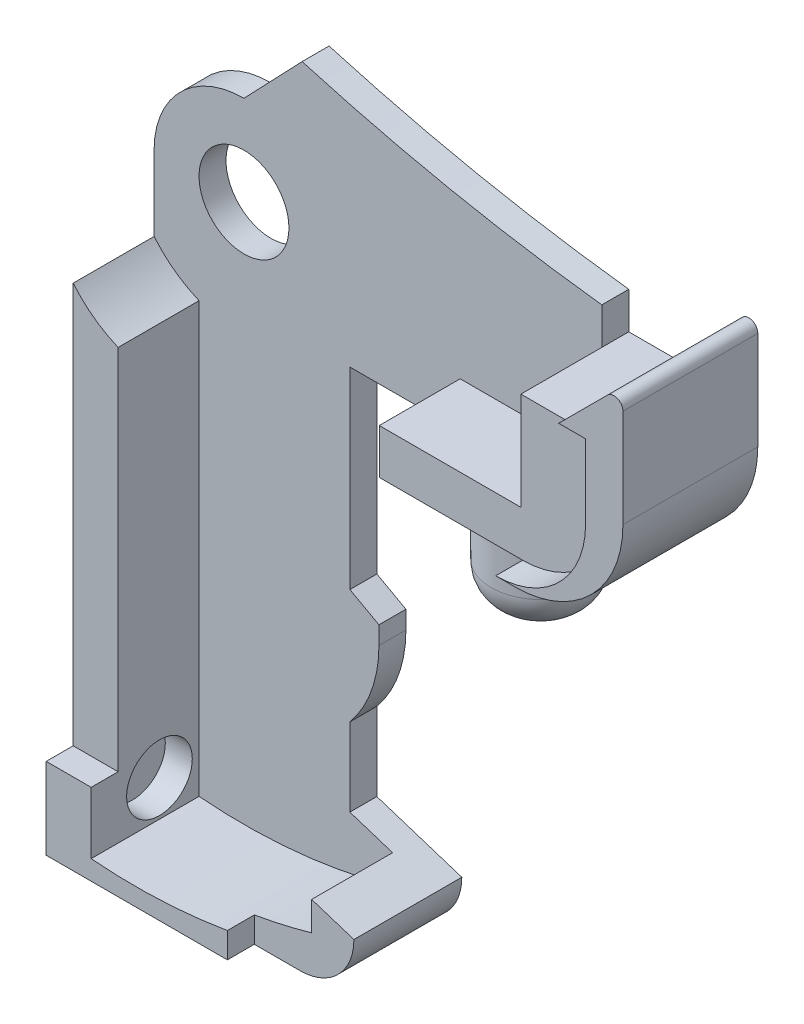
from build123d import *

# Parameters (mm, degrees)
EXTRUDE_3_DEPTH     = 7.5
EXTRUDE_3_2_DEPTH   = 7.5
EXTRUDE_4_DEPTH     = 6
SKETCH_1_8_R        = 2.5
EXTRUDE_5_DEPTH     = 1.5
SKETCH_2_R          = 2.75
EXTRUDE_6_DEPTH     = 2.45
SKETCH_4_R          = 2.75
EXTRUDE_7_DEPTH     = 2
SKETCH_5_R          = 1.825
CUT_EXTRUDE_1_DEPTH = 1.5


with BuildPart() as part:
    # 스케치1 → 보스-돌출3 (new body)
    with BuildSketch(Plane.XY):
        with BuildLine():
            Line((-2.5, -26.437677825), (-5, -26.437677825))
            Line((-5, -26.437677825), (-5, -30.96175738))
            Line((-5, -30.96175738), (5.076141326, -30.96175738))
            Line((5.076141326, -30.96175738), (5.076141326, -29.54601506))
            ThreePointArc((5.076141326, -29.54601506), (1.298498135, -29.950761581), (-2.5, -29.874474333))
            Line((-2.5, -29.874474333), (-2.5, -26.437677825))
        make_face()
    extrude(amount=EXTRUDE_3_DEPTH)

    # 스케치1<7> → 보스-돌출4 (add)
    with BuildSketch(Plane.XY):
        with BuildLine():
            Line((23.5, 2.950728465), (19.9, 2.950728465))
            Line((19.9, 2.950728465), (19.9, -2.5))
            Line((19.9, -2.5), (12.023157318, -2.5))
            Line((12.023157318, -2.5), (12.023157318, -5))
            Line((12.023157318, -5), (20, -5))
            ThreePointArc((20, -5), (23.535533906, -3.535533906), (25, 0))
            Line((25, 0), (25, 4.09591659))
            Line((25, 4.09591659), (23.5, 4.09591659))
            Line((23.5, 4.09591659), (23.5, 2.950728465))
        make_face()
        with BuildLine():
            ThreePointArc((-2.5, -6), (-3.862002616, -5.228282299), (-5, -4.153311931))
            Line((-5, -4.153311931), (-5, -26.437677825))
            Line((-5, -26.437677825), (-2.5, -26.437677825))
            Line((-2.5, -26.437677825), (-2.5, -6))
        make_face()
        with BuildLine():
            Line((5.076141326, -29.54601506), (5.076141326, -30.96175738))
            Line((5.076141326, -30.96175738), (7.613716386, -30.96175738))
            ThreePointArc((7.613716386, -30.96175738), (9.735036729, -30.083077723), (10.613716386, -27.96175738))
            Line((10.613716386, -27.96175738), (8.264928228, -27.20398111))
            Line((8.264928228, -27.20398111), (8.264928228, -28.81709871))
            ThreePointArc((8.264928228, -28.81709871), (6.680483813, -29.225080884), (5.076141326, -29.54601506))
        make_face()
    extrude(amount=EXTRUDE_4_DEPTH)


with BuildPart() as body_2:
    # 스케치1 → Extrude 3 2 (new body)
    with BuildSketch(Plane.XY):
        with BuildLine():
            ThreePointArc((26.22215467, 6.81807126), (26.767049777, 6.926457636), (27.075708061, 6.46451787))
            Line((27.075708061, 6.46451787), (27.075708061, 1))
            ThreePointArc((27.075708061, 1), (25.318348748, -3.242640687), (21.075708061, -5))
            Line((21.075708061, -5), (20, -5))
            ThreePointArc((20, -5), (23.535533906, -3.535533906), (25, 0))
            Line((25, 0), (25, 4.09591659))
            Line((25, 4.09591659), (23.5, 4.09591659))
            Line((23.5, 4.09591659), (26.22215467, 6.81807126))
        make_face()
    extrude(amount=EXTRUDE_3_2_DEPTH)


with BuildPart() as extrude_4_piece_1:
    # of the separate pieces the step leaves, piece 1, a body of its own (extrude_4_pieces)
    add(part.part.solids().sort_by_distance((-2.5, -29.874474333, 0))[0])



with BuildPart() as extrude_4_piece_2:
    # of the separate pieces the step leaves, piece 2, a body of its own (extrude_4_pieces)
    add(part.part.solids().sort_by_distance((23.5, 2.950728465, 0))[0])


with BuildPart() as extrude_4_piece_1_1:
    add(extrude_4_piece_1.part)

    add(extrude_4_piece_2.part)  # 보스-돌출5 merges 보스-돌출4 piece 2
    # 스케치1<8> → 보스-돌출5 (add)
    with BuildSketch(Plane.XY):
        with BuildLine():
            Line((3.231912185, 8.38327913), (0, 5))
            ThreePointArc((0, 5), (-3.535533906, 3.535533906), (-5, 0))
            Line((-5, 0), (-5, -4.153311931))
            ThreePointArc((-5, -4.153311931), (-3.862002616, -5.228282299), (-2.5, -6))
            Line((-2.5, -6), (-2.5, -29.874474333))
            ThreePointArc((-2.5, -29.874474333), (2.93054776, -29.83531643), (8.264928228, -28.81709871))
            Line((8.264928228, -28.81709871), (8.264928228, -27.20398111))
            Line((8.264928228, -27.20398111), (5.889404941, -26.437579436))
            Line((5.889404941, -26.437579436), (5.889404941, -22.090836604))
            ThreePointArc((5.889404941, -22.090836604), (7.089676261, -19.98856225), (7.506209453, -17.603880133))
            Line((7.506209453, -17.603880133), (7.506209453, -16.606122356))
            Line((7.506209453, -16.606122356), (5.889404941, -15.718789718))
            Line((5.889404941, -15.718789718), (5.889404941, -5))
            Line((5.889404941, -5), (12.023157318, -5))
            Line((12.023157318, -5), (12.023157318, -2.5))
            Line((12.023157318, -2.5), (19.9, -2.5))
            Line((19.9, -2.5), (19.9, 5))
            ThreePointArc((19.9, 5), (11.496170313, 6.34783243), (3.231912185, 8.38327913))
        make_face()
        Circle(SKETCH_1_8_R, mode=Mode.SUBTRACT)
    extrude(amount=EXTRUDE_5_DEPTH)

    # 스케치2 → 보스-돌출6 (add, symmetric)
    with BuildSketch(Plane.XZ.offset(5)):
        with Locations(Location((18, 3, 0), (0, 0, 43.341758227))):
            Circle(SKETCH_2_R)
    extrude(amount=EXTRUDE_6_DEPTH, both=True)

    # 스케치4 → 보스-돌출7 (add)
    with BuildSketch(Plane.XZ.offset(7.45)):
        with Locations(Location((18, 3, 0), (0, 0, 43.341758227))):
            Circle(SKETCH_4_R)
    extrude(amount=EXTRUDE_7_DEPTH)

    # 스케치5 → 컷-돌출1 (cut)
    with BuildSketch(Plane(origin=(-2.5, 0, 0), x_dir=(0, 0, -1), z_dir=(1, 0, 0))):
        with Locations((-3.7, -27.874474333)):
            Circle(SKETCH_5_R)
    extrude(amount=-CUT_EXTRUDE_1_DEPTH, mode=Mode.SUBTRACT)

    # 필렛1: read off the stored shape, not the designer's step
    # 필렛1 outline → 필렛1 (revolve, cut)
    with BuildSketch(Plane(origin=(18, 0, 3), x_dir=(1, 0, 0), z_dir=(0, 0, 1))):
        with BuildLine():
            Line((2.75, -9.45), (2.75, -7.45))
            ThreePointArc((2.75, -7.45), (2.164213562, -8.864213562), (0.75, -9.45))
            Line((0.75, -9.45), (2.75, -9.45))
        make_face()
    revolve(axis=Axis((18, 0, 3), (0, 1, 0)), mode=Mode.SUBTRACT)


solid = Compound([body_2.part, extrude_4_piece_1_1.part])
